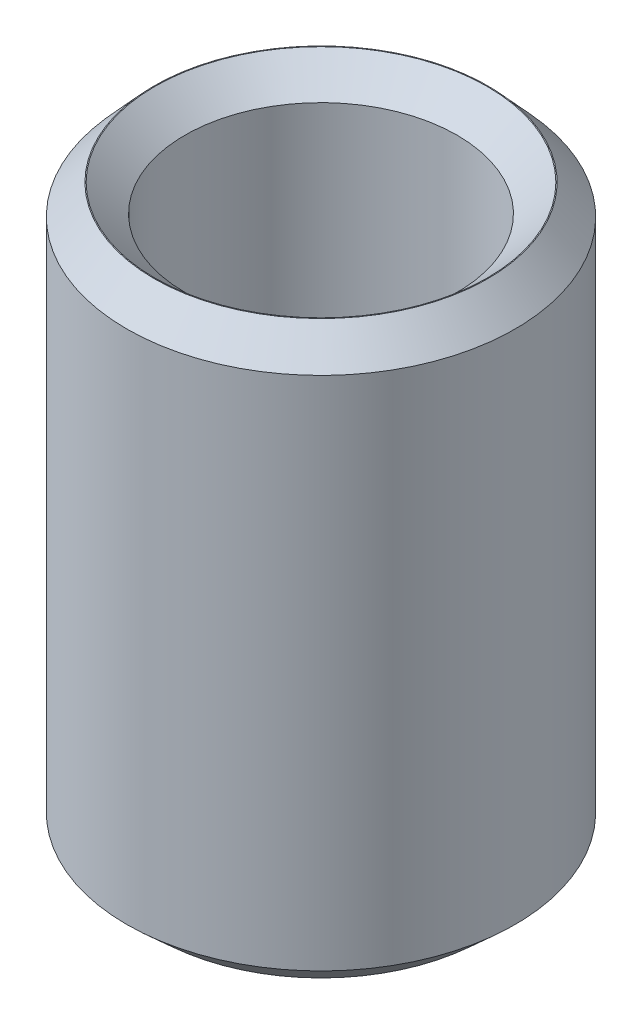
from build123d import *
from OCP.BRepFilletAPI import BRepFilletAPI_MakeChamfer

# Parameters (mm, degrees)
SKETCH1_R           = 22.5
BOSS_EXTRUDE1_DEPTH = 66.375983789
SKETCH2_R           = 15.767346976
CUT_EXTRUDE1_DEPTH  = 74.608907232
CHAMFER1_SIZE       = 3.471401953
CHAMFER1_SIZE2      = 3.159647701


with BuildPart() as part:
    # Sketch1 → Boss-Extrude1 (new body)
    with BuildSketch(Plane(origin=(0, 0, 0), x_dir=(1, 0, 0), z_dir=(0, 1, 0))):
        Circle(SKETCH1_R)
    extrude(amount=BOSS_EXTRUDE1_DEPTH)

    # Sketch2 → Cut-Extrude1 (cut, through all)
    with BuildSketch(Plane(origin=(0, 0, 0), x_dir=(1, 0, 0), z_dir=(0, 1, 0))):
        Circle(SKETCH2_R)
    extrude(amount=CUT_EXTRUDE1_DEPTH, mode=Mode.SUBTRACT)

    # Chamfer1: one chamfer whose edges measure the first distance from different faces: ONE call of the kernel's chamfer builder (chamfer() names one face for all edges)
    chamfer1_edges_1 = [part.edges().sort_by_distance(p)[0] for p in [
        (-15.767346976, 66.375983789, 0),
    ]]
    chamfer1_side_1 = [part.faces().sort_by_distance(p)[0] for p in [
        (-21.863603897, 66.375983789, 0),
    ]]
    chamfer1_edges_2 = [part.edges().sort_by_distance(p)[0] for p in [
        (-15.767346976, 0, 0),
    ]]
    chamfer1_side_2 = [part.faces().sort_by_distance(p)[0] for p in [
        (-15.767346976, 33.187991895, 0),
    ]]
    chamfer1_edges_3 = [part.edges().sort_by_distance(p)[0] for p in [
        (-22.5, 0, 0),
    ]]
    chamfer1_side_3 = [part.faces().sort_by_distance(p)[0] for p in [
        (-21.863603897, 0, 0),
    ]]
    chamfer1_edges_4 = [part.edges().sort_by_distance(p)[0] for p in [
        (-22.5, 66.375983789, 0),
    ]]
    chamfer1_side_4 = [part.faces().sort_by_distance(p)[0] for p in [
        (-22.5, 33.187991895, 0),
    ]]
    chamfer1 = BRepFilletAPI_MakeChamfer(part.part.solid().wrapped)
    for e in chamfer1_edges_1:
        chamfer1.Add(CHAMFER1_SIZE, CHAMFER1_SIZE2, e.wrapped, chamfer1_side_1[0].wrapped)  # the first distance lies on this face
    for e in chamfer1_edges_2:
        chamfer1.Add(CHAMFER1_SIZE, CHAMFER1_SIZE2, e.wrapped, chamfer1_side_2[0].wrapped)  # the first distance lies on this face
    for e in chamfer1_edges_3:
        chamfer1.Add(CHAMFER1_SIZE, CHAMFER1_SIZE2, e.wrapped, chamfer1_side_3[0].wrapped)  # the first distance lies on this face
    for e in chamfer1_edges_4:
        chamfer1.Add(CHAMFER1_SIZE, CHAMFER1_SIZE2, e.wrapped, chamfer1_side_4[0].wrapped)  # the first distance lies on this face
    add(Compound.cast(chamfer1.Shape()), mode=Mode.REPLACE)


solid = part.part
